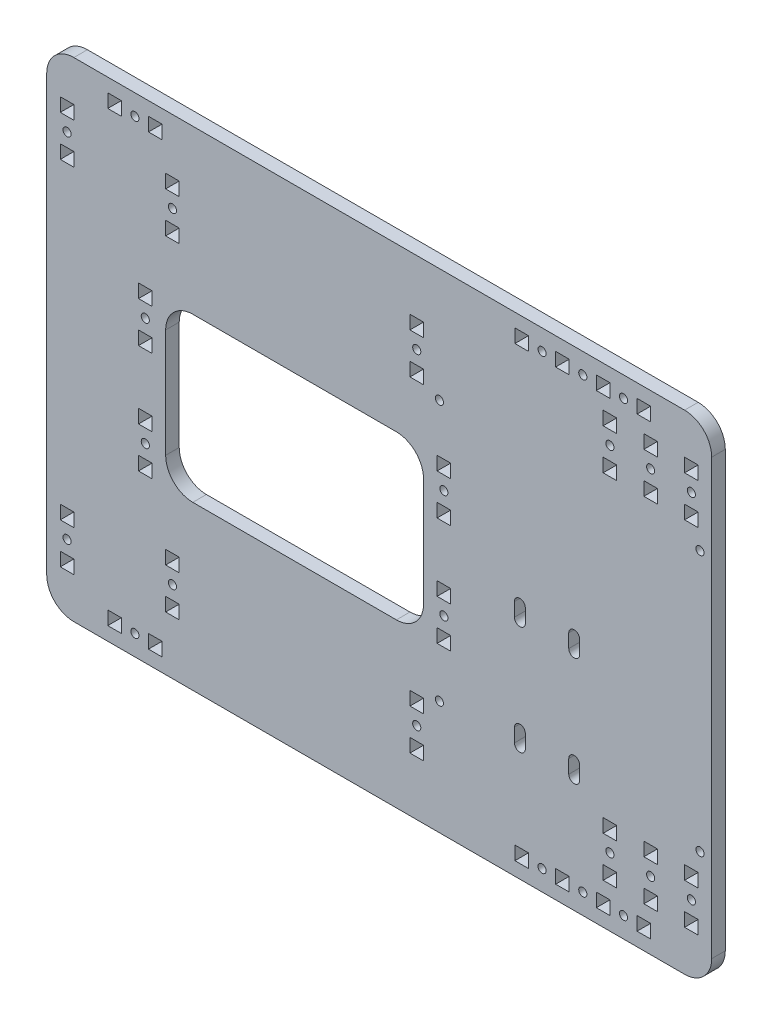
from build123d import *

# Parameters (mm, degrees)
SKETCH1_W           = 245.000446045
SKETCH1_H           = 180
SKETCH1_W_2         = 5
SKETCH1_H_2         = 5
SKETCH1_R           = 1.5
SKETCH1_W_3         = 95
SKETCH1_H_3         = 60
BOSS_EXTRUDE1_DEPTH = 5
FILLET1_R           = 10


with BuildPart() as part:
    # Sketch1 → Boss-Extrude1 (new body)
    with BuildSketch(Plane.XY):
        with Locations((31.175821468, 0)):
            Rectangle(SKETCH1_W, SKETCH1_H)
        with Locations((-66.324847601, -82.5)):
            Rectangle(SKETCH1_W_2, SKETCH1_H_2, mode=Mode.SUBTRACT)
        with Locations((-83.824401555, -72.5)):
            Rectangle(SKETCH1_W_2, SKETCH1_H_2, mode=Mode.SUBTRACT)
        with Locations((-58.824847601, -82.5)):
            Circle(SKETCH1_R, mode=Mode.SUBTRACT)
        with Locations((-51.324847601, -82.5)):
            Rectangle(SKETCH1_W_2, SKETCH1_H_2, mode=Mode.SUBTRACT)
        with Locations((-83.824401555, -65)):
            Circle(SKETCH1_R, mode=Mode.SUBTRACT)
        with Locations((-83.824401555, -57.5)):
            Rectangle(SKETCH1_W_2, SKETCH1_H_2, mode=Mode.SUBTRACT)
        with Locations((-45, -67.5)):
            Rectangle(SKETCH1_W_2, SKETCH1_H_2, mode=Mode.SUBTRACT)
        with Locations((-45, -60)):
            Circle(SKETCH1_R, mode=Mode.SUBTRACT)
        with Locations((-45, -52.5)):
            Rectangle(SKETCH1_W_2, SKETCH1_H_2, mode=Mode.SUBTRACT)
        with Locations((-55, -27.5)):
            Rectangle(SKETCH1_W_2, SKETCH1_H_2, mode=Mode.SUBTRACT)
        with Locations((-55, -20)):
            Circle(SKETCH1_R, mode=Mode.SUBTRACT)
        with Locations((-55, -12.5)):
            Rectangle(SKETCH1_W_2, SKETCH1_H_2, mode=Mode.SUBTRACT)
        with Locations((83.67604449, -82.5)):
            Rectangle(SKETCH1_W_2, SKETCH1_H_2, mode=Mode.SUBTRACT)
        with Locations((91.17604449, -82.5)):
            Circle(SKETCH1_R, mode=Mode.SUBTRACT)
        with Locations((45, -67.5)):
            Rectangle(SKETCH1_W_2, SKETCH1_H_2, mode=Mode.SUBTRACT)
        with Locations((45, -60)):
            Circle(SKETCH1_R, mode=Mode.SUBTRACT)
        with Locations((45, -52.5)):
            Rectangle(SKETCH1_W_2, SKETCH1_H_2, mode=Mode.SUBTRACT)
        with Locations((53.355041852, -48)):
            Circle(SKETCH1_R, mode=Mode.SUBTRACT)
        with Locations((98.67604449, -82.5)):
            Rectangle(SKETCH1_W_2, SKETCH1_H_2, mode=Mode.SUBTRACT)
        with Locations((106.17604449, -82.5)):
            Circle(SKETCH1_R, mode=Mode.SUBTRACT)
        with Locations((113.67604449, -82.5)):
            Rectangle(SKETCH1_W_2, SKETCH1_H_2, mode=Mode.SUBTRACT)
        with Locations((121.17604449, -82.5)):
            Circle(SKETCH1_R, mode=Mode.SUBTRACT)
        with Locations((116.17604449, -72.5)):
            Rectangle(SKETCH1_W_2, SKETCH1_H_2, mode=Mode.SUBTRACT)
        with Locations((128.67604449, -82.5)):
            Rectangle(SKETCH1_W_2, SKETCH1_H_2, mode=Mode.SUBTRACT)
        with Locations((131.17604449, -72.5)):
            Rectangle(SKETCH1_W_2, SKETCH1_H_2, mode=Mode.SUBTRACT)
        with Locations((146.17604449, -72.5)):
            Rectangle(SKETCH1_W_2, SKETCH1_H_2, mode=Mode.SUBTRACT)
        with Locations((116.17604449, -65)):
            Circle(SKETCH1_R, mode=Mode.SUBTRACT)
        with Locations((116.17604449, -57.5)):
            Rectangle(SKETCH1_W_2, SKETCH1_H_2, mode=Mode.SUBTRACT)
        with Locations((131.17604449, -65)):
            Circle(SKETCH1_R, mode=Mode.SUBTRACT)
        with Locations((131.17604449, -57.5)):
            Rectangle(SKETCH1_W_2, SKETCH1_H_2, mode=Mode.SUBTRACT)
        with Locations((146.17604449, -65)):
            Circle(SKETCH1_R, mode=Mode.SUBTRACT)
        with Locations((146.17604449, -57.5)):
            Rectangle(SKETCH1_W_2, SKETCH1_H_2, mode=Mode.SUBTRACT)
        with Locations((149.355041852, -48)):
            Circle(SKETCH1_R, mode=Mode.SUBTRACT)
        with Locations((55, -27.5)):
            Rectangle(SKETCH1_W_2, SKETCH1_H_2, mode=Mode.SUBTRACT)
        with BuildLine():
            ThreePointArc((85, -47.5), (83, -49.5), (81, -47.5))
            Line((81, -47.5), (81, -42.5))
            ThreePointArc((81, -42.5), (83, -40.5), (85, -42.5))
            Line((85, -42.5), (85, -47.5))
        make_face(mode=Mode.SUBTRACT)
        with Locations((55, -20)):
            Circle(SKETCH1_R, mode=Mode.SUBTRACT)
        with Locations((55, -12.5)):
            Rectangle(SKETCH1_W_2, SKETCH1_H_2, mode=Mode.SUBTRACT)
        with BuildLine():
            ThreePointArc((85, -7.400179563), (83, -9.400179563), (81, -7.400179563))
            Line((81, -7.400179563), (81, -2.400179563))
            ThreePointArc((81, -2.400179563), (83, -0.400179563), (85, -2.400179563))
            Line((85, -2.400179563), (85, -7.400179563))
        make_face(mode=Mode.SUBTRACT)
        with BuildLine():
            ThreePointArc((105, -47.5), (103, -49.5), (101, -47.5))
            Line((101, -47.5), (101, -42.5))
            ThreePointArc((101, -42.5), (103, -40.5), (105, -42.5))
            Line((105, -42.5), (105, -47.5))
        make_face(mode=Mode.SUBTRACT)
        with BuildLine():
            ThreePointArc((105, -7.400179563), (103, -9.400179563), (101, -7.400179563))
            Line((101, -7.400179563), (101, -2.400179563))
            ThreePointArc((101, -2.400179563), (103, -0.400179563), (105, -2.400179563))
            Line((105, -2.400179563), (105, -7.400179563))
        make_face(mode=Mode.SUBTRACT)
        with Locations((-55, 12.5)):
            Rectangle(SKETCH1_W_2, SKETCH1_H_2, mode=Mode.SUBTRACT)
        with Locations((-55, 20)):
            Circle(SKETCH1_R, mode=Mode.SUBTRACT)
        with Locations((-55, 27.5)):
            Rectangle(SKETCH1_W_2, SKETCH1_H_2, mode=Mode.SUBTRACT)
        Rectangle(SKETCH1_W_3, SKETCH1_H_3, mode=Mode.SUBTRACT)
        with Locations((-83.824401555, 57.5)):
            Rectangle(SKETCH1_W_2, SKETCH1_H_2, mode=Mode.SUBTRACT)
        with Locations((-83.824401555, 65)):
            Circle(SKETCH1_R, mode=Mode.SUBTRACT)
        with Locations((-45, 52.5)):
            Rectangle(SKETCH1_W_2, SKETCH1_H_2, mode=Mode.SUBTRACT)
        with Locations((-45, 60)):
            Circle(SKETCH1_R, mode=Mode.SUBTRACT)
        with Locations((-45, 67.5)):
            Rectangle(SKETCH1_W_2, SKETCH1_H_2, mode=Mode.SUBTRACT)
        with Locations((-83.824401555, 72.5)):
            Rectangle(SKETCH1_W_2, SKETCH1_H_2, mode=Mode.SUBTRACT)
        with Locations((-66.324847601, 82.5)):
            Rectangle(SKETCH1_W_2, SKETCH1_H_2, mode=Mode.SUBTRACT)
        with Locations((-58.824847601, 82.5)):
            Circle(SKETCH1_R, mode=Mode.SUBTRACT)
        with Locations((-51.324847601, 82.5)):
            Rectangle(SKETCH1_W_2, SKETCH1_H_2, mode=Mode.SUBTRACT)
        with Locations((55, 12.5)):
            Rectangle(SKETCH1_W_2, SKETCH1_H_2, mode=Mode.SUBTRACT)
        with Locations((55, 20)):
            Circle(SKETCH1_R, mode=Mode.SUBTRACT)
        with Locations((55, 27.5)):
            Rectangle(SKETCH1_W_2, SKETCH1_H_2, mode=Mode.SUBTRACT)
        with Locations((45, 52.5)):
            Rectangle(SKETCH1_W_2, SKETCH1_H_2, mode=Mode.SUBTRACT)
        with Locations((53.355041852, 48)):
            Circle(SKETCH1_R, mode=Mode.SUBTRACT)
        with Locations((45, 60)):
            Circle(SKETCH1_R, mode=Mode.SUBTRACT)
        with Locations((45, 67.5)):
            Rectangle(SKETCH1_W_2, SKETCH1_H_2, mode=Mode.SUBTRACT)
        with Locations((83.676044481, 82.5)):
            Rectangle(SKETCH1_W_2, SKETCH1_H_2, mode=Mode.SUBTRACT)
        with Locations((91.176044481, 82.5)):
            Circle(SKETCH1_R, mode=Mode.SUBTRACT)
        with Locations((116.17604449, 57.5)):
            Rectangle(SKETCH1_W_2, SKETCH1_H_2, mode=Mode.SUBTRACT)
        with Locations((116.17604449, 65)):
            Circle(SKETCH1_R, mode=Mode.SUBTRACT)
        with Locations((149.355041852, 48)):
            Circle(SKETCH1_R, mode=Mode.SUBTRACT)
        with Locations((131.17604449, 57.5)):
            Rectangle(SKETCH1_W_2, SKETCH1_H_2, mode=Mode.SUBTRACT)
        with Locations((131.17604449, 65)):
            Circle(SKETCH1_R, mode=Mode.SUBTRACT)
        with Locations((146.17604449, 57.5)):
            Rectangle(SKETCH1_W_2, SKETCH1_H_2, mode=Mode.SUBTRACT)
        with Locations((146.17604449, 65)):
            Circle(SKETCH1_R, mode=Mode.SUBTRACT)
        with Locations((116.17604449, 72.5)):
            Rectangle(SKETCH1_W_2, SKETCH1_H_2, mode=Mode.SUBTRACT)
        with Locations((98.67604449, 82.5)):
            Rectangle(SKETCH1_W_2, SKETCH1_H_2, mode=Mode.SUBTRACT)
        with Locations((106.17604449, 82.5)):
            Circle(SKETCH1_R, mode=Mode.SUBTRACT)
        with Locations((113.67604449, 82.5)):
            Rectangle(SKETCH1_W_2, SKETCH1_H_2, mode=Mode.SUBTRACT)
        with Locations((121.17604449, 82.5)):
            Circle(SKETCH1_R, mode=Mode.SUBTRACT)
        with Locations((131.17604449, 72.5)):
            Rectangle(SKETCH1_W_2, SKETCH1_H_2, mode=Mode.SUBTRACT)
        with Locations((146.17604449, 72.5)):
            Rectangle(SKETCH1_W_2, SKETCH1_H_2, mode=Mode.SUBTRACT)
        with Locations((128.67604449, 82.5)):
            Rectangle(SKETCH1_W_2, SKETCH1_H_2, mode=Mode.SUBTRACT)
    extrude(amount=BOSS_EXTRUDE1_DEPTH)

    # Fillet1
    fillet1_edges = [part.edges().sort_by_distance(p)[0] for p in [
        (-91.324401555, 90, 2.5),
        (-91.324401555, -90, 2.5),
        (153.67604449, 90, 2.5),
        (153.67604449, -90, 2.5),
        (-47.5, -30, 2.5),
        (-47.5, 30, 2.5),
        (47.5, 30, 2.5),
        (47.5, -30, 2.5),
    ]]
    fillet(fillet1_edges, radius=FILLET1_R)


solid = part.part
